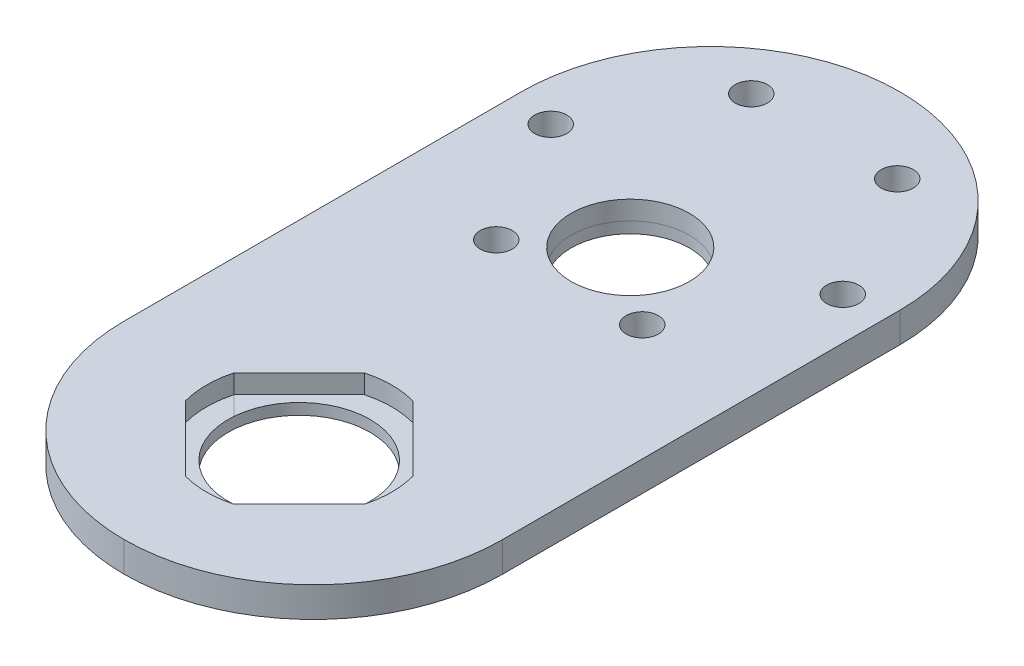
from build123d import *

# Parameters (mm, degrees)
CROQUIS1_W                   = 40
CROQUIS1_H                   = 82
BRIDA_BASE1_DEPTH            = 3.175
CROQUIS6_R                   = 6.25
CORTAR_EXTRUIR17_DEPTH       = 2
CORTAR_EXTRUIR5_START        = -10
CROQUIS5_R                   = 7.5
CROQUIS5_R_2                 = 6.25
CORTAR_EXTRUIR5_DEPTH        = 10
REDONDEO1_R                  = 20
TALADRO_DE_MARGEN_PARA_M31_D = 3.4


# Sheet-metal steps are written as plain solids
with BuildPart() as part:
    # Croquis1 → Brida base1 (new body)
    with BuildSketch(Plane(origin=(0, 0, 0), x_dir=(1, 0, 0), z_dir=(0, 1, 0))):
        with Locations((-40.908481915, 11.276700353)):
            Rectangle(CROQUIS1_W, CROQUIS1_H)
    extrude(amount=-BRIDA_BASE1_DEPTH)

    # Croquis6 → Cortar-Extruir17 (cut)
    with BuildSketch(Plane(origin=(0, 0, 0), x_dir=(1, 0, 0), z_dir=(0, 1, 0))):
        with Locations(Location((-40.908481915, 23.776700353, 0), (0, 0, 270))):
            Circle(CROQUIS6_R)
        with BuildLine():
            Line((-43.469976683, -1.763979135), (-50.367802427, -8.661804879))
            ThreePointArc((-50.367802427, -8.661804879), (-50.708481915, -11.223299647), (-50.367802427, -13.784794415))
            Line((-50.367802427, -13.784794415), (-43.469976683, -20.682620159))
            ThreePointArc((-43.469976683, -20.682620159), (-40.908481915, -21.023299647), (-38.346987147, -20.682620159))
            Line((-38.346987147, -20.682620159), (-31.449161403, -13.784794415))
            ThreePointArc((-31.449161403, -13.784794415), (-31.108481915, -11.223299647), (-31.449161403, -8.661804879))
            Line((-31.449161403, -8.661804879), (-38.346987147, -1.763979135))
            ThreePointArc((-38.346987147, -1.763979135), (-40.908481915, -1.423299647), (-43.469976683, -1.763979135))
        make_face()
    extrude(amount=-CORTAR_EXTRUIR17_DEPTH, mode=Mode.SUBTRACT)

    # Croquis5 → Cortar-Extruir5 (cut)
    with BuildSketch(Plane.XZ.offset(3.175).offset(CORTAR_EXTRUIR5_START)):
        with Locations(Location((-40.908481915, 11.223299647, 0), (0, 0, 270))):
            Circle(CROQUIS5_R)
        with Locations(Location((-40.908481915, -23.776700353, 0), (0, 0, 90))):
            Circle(CROQUIS5_R_2)
    extrude(amount=CORTAR_EXTRUIR5_DEPTH, mode=Mode.SUBTRACT)

    # Redondeo1
    redondeo1_edges = [part.edges().sort_by_distance(p)[0] for p in [
        (-60.908481915, -1.5875, -52.276700353),
        (-20.908481915, -1.5875, -52.276700353),
        (-20.908481915, -1.5875, 29.723299647),
        (-60.908481915, -1.5875, 29.723299647),
    ]]
    fillet(redondeo1_edges, radius=REDONDEO1_R - 0.0001)  # a hair under: the kernel refuses the full size

    # Taladro de margen para M31 (through all)
    with Locations(Plane(origin=(-178.498967671, -3.175, 246.519317109), x_dir=(0.8065687193086877, 0, 0.59114033954108), z_dir=(0, -1, 0))):
        with Locations((-65.46157961, -295.903051669), (-67.078989392, -311.31843313), (-51.302762764, -289.596078899), (-54.537582329, -320.426841821), (-40.378765484, -314.119869051), (-38.761355701, -298.70448759)):
            Hole(TALADRO_DE_MARGEN_PARA_M31_D / 2)


solid = part.part
